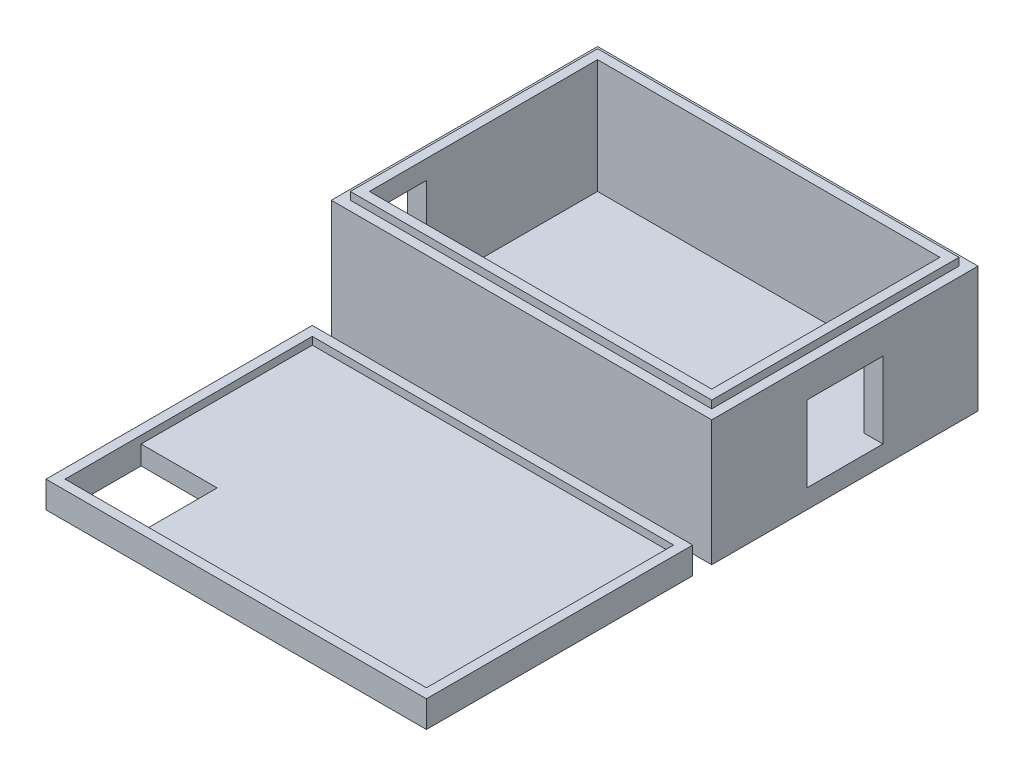
from build123d import *

# Parameters (mm, degrees)
SKETCH_1_W           = 100
SKETCH_1_H           = 70
EXTRUDE_9_DEPTH      = 40
SKETCH_7_W           = 90
SKETCH_7_H           = 60
CUT_EXTRUDE_1_DEPTH  = 35
SKETCH_8_W           = 95
SKETCH_8_H           = 65
CUT_EXTRUDE_3_DEPTH  = 5
SKETCH_1_6_W         = 100
SKETCH_1_6_H         = 70
SKETCH_1_6_W_2       = 90
SKETCH_1_6_H_2       = 60
EXTRUDE_11_DEPTH     = 10
SKETCH_12_W          = 90
SKETCH_12_H          = 60
CUT_EXTRUDE_6_DEPTH  = 5
SKETCH_13_W          = 95
SKETCH_13_H          = 65
CUT_EXTRUDE_7_DEPTH  = 5
SKETCH_18_W          = 100
SKETCH_18_H          = 70
SKETCH_18_W_2        = 95
SKETCH_18_H_2        = 65
CUT_EXTRUDE_10_DEPTH = 7
SKETCH_19_W          = 100
SKETCH_19_H          = 70
CUT_EXTRUDE_12_DEPTH = 3
SKETCH_20_W          = 20
SKETCH_20_H          = 20
CUT_EXTRUDE_14_DEPTH = 13
SKETCH_21_W          = 15
SKETCH_21_H          = 10
CUT_EXTRUDE_16_DEPTH = 13
SKETCH_22_W          = 20
SKETCH_22_H          = 20
CUT_EXTRUDE_17_DEPTH = 13
EXTRUDE_12_DEPTH     = 4


# Read off the part's stored shape, not the designer's step: 凸台-拉伸12
with BuildPart() as part:
    # 草图1 → 凸台-拉伸9 (new body)
    with BuildSketch(Plane(origin=(0, 0, 0), x_dir=(1, 0, 0), z_dir=(0, 1, 0))):
        with Locations((50, 35)):
            Rectangle(SKETCH_1_W, SKETCH_1_H)
    extrude(amount=EXTRUDE_9_DEPTH)

    # 草图7 → 切除-拉伸1 (cut)
    with BuildSketch(Plane(origin=(0, 40, 0), x_dir=(1, 0, 0), z_dir=(0, 1, 0))):
        with Locations((50, 35)):
            Rectangle(SKETCH_7_W, SKETCH_7_H)
    extrude(amount=-CUT_EXTRUDE_1_DEPTH, mode=Mode.SUBTRACT)

    # 草图8 → 切除-拉伸3 (cut)
    with BuildSketch(Plane(origin=(0, 40, 0), x_dir=(1, 0, 0), z_dir=(0, 1, 0))):
        with Locations((50, 35)):
            Rectangle(SKETCH_8_W, SKETCH_8_H)
    extrude(amount=-CUT_EXTRUDE_3_DEPTH, mode=Mode.SUBTRACT)

    # 草图1<6> → 凸台-拉伸11 (add)
    # profile 1 of 2: a face of its own
    with BuildSketch(Plane(origin=(0, 0, 0), x_dir=(1, 0, 0), z_dir=(0, 1, 0))):
        with Locations((50, 35)):
            Rectangle(SKETCH_1_6_W, SKETCH_1_6_H)
        with Locations((50, 35)):
            Rectangle(SKETCH_1_6_W_2, SKETCH_1_6_H_2, mode=Mode.SUBTRACT)
    # profile 2 of 2: a face of its own
    with BuildSketch(Plane(origin=(0, 0, 0), x_dir=(1, 0, 0), z_dir=(0, 1, 0))):
        with Locations((50, -40)):
            Rectangle(SKETCH_1_6_W, SKETCH_1_6_H)
    extrude(amount=EXTRUDE_11_DEPTH)


with BuildPart() as extrude_11_piece_1:
    # of the separate pieces the step leaves, piece 1, a body of its own (extrude_11_pieces)
    add(part.part.solids().sort_by_distance((0, 0, 0))[0])

    # 草图18 → 切除-拉伸10 (cut)
    with BuildSketch(Plane(origin=(0, 40, 0), x_dir=(1, 0, 0), z_dir=(0, 1, 0))):
        with Locations((50, 35)):
            Rectangle(SKETCH_18_W, SKETCH_18_H)
        with Locations((50, 35)):
            Rectangle(SKETCH_18_W_2, SKETCH_18_H_2, mode=Mode.SUBTRACT)
    extrude(amount=-CUT_EXTRUDE_10_DEPTH, mode=Mode.SUBTRACT)

    # 草图20 → 切除-拉伸14 (cut)
    with BuildSketch(Plane(origin=(100, 0, 0), x_dir=(0, 0, -1), z_dir=(1, 0, 0))):
        with Locations((35, 15)):
            Rectangle(SKETCH_20_W, SKETCH_20_H)
    extrude(amount=-CUT_EXTRUDE_14_DEPTH, mode=Mode.SUBTRACT)

    # 草图21 → 切除-拉伸16 (cut)
    with BuildSketch(Plane.ZY):
        with Locations((-12.5, 25)):
            Rectangle(SKETCH_21_W, SKETCH_21_H)
    extrude(amount=-CUT_EXTRUDE_16_DEPTH, mode=Mode.SUBTRACT)

    # 凸台-拉伸12 outline → 凸台-拉伸12 (add)
    # profile 1 of 6: a face of its own
    with BuildSketch(Plane(origin=(0, 0, -70), x_dir=(-1, 0, 0), z_dir=(0, 0, -1))):
        with BuildLine():
            add(Edge.make_bspline(
                [(-69.525171651, 18.592004553), (-70.286665441, 18.592004553), (-70.540496704, 18.972751448), (-70.413581072, 19.321769435)],
                knots=[0, 0, 0, 0, 1, 1, 1, 1], degree=3))
            add(Edge.make_bspline(
                [(-70.350123256, 16.624812262), (-70.286665441, 17.767052947), (-69.556900559, 18.544411191), (-69.525171651, 18.592004553)],
                knots=[0, 0, 0, 0, 1, 1, 1, 1], degree=3))
            add(Edge.make_bspline(
                [(-72.745655804, 14.245144168), (-70.350123256, 16.323387637), (-70.350123256, 16.624812262)],
                knots=[0, 0, 0, 1, 1, 1], degree=2))
            add(Edge.make_bspline(
                [(-70.873650237, 15.038366866), (-72.317315547, 12.753885496), (-72.840842528, 12.753885496), (-72.840842528, 12.722156588), (-72.872571436, 12.76974995), (-73.300911693, 14.245144168), (-72.745655804, 14.245144168)],
                knots=[0, 0, 0, 0, 0, 0, 0, 1, 1, 1, 1, 1, 1, 1], degree=6))
            add(Edge.make_bspline(
                [(-69.207882571, 15.958505196), (-70.491669381, 14.039684199), (-70.651547882, 14.086499628), (-70.571608631, 14.063091914), (-70.715005698, 15.101824682), (-70.873650237, 15.038366866)],
                knots=[0, 0, 0, 0, 0, 0, 1, 1, 1, 1, 1, 1], degree=5))
            add(Edge.make_bspline(
                [(-68.39879542, 15.228740313), (-68.827135676, 15.371520399), (-68.827135676, 15.958505196), (-69.207882571, 15.958505196)],
                knots=[0, 0, 0, 0, 1, 1, 1, 1], degree=3))
            add(Edge.make_bspline(
                [(-66.288823043, 17.386306052), (-68.040058644, 16.095169124), (-68.040058644, 15.482571577), (-68.39879542, 15.228740313)],
                knots=[0, 0, 0, 0, 1, 1, 1, 1], degree=3))
            add(Edge.make_bspline(
                [(-67.764217261, 13.911990635), (-67.351741458, 13.911990635), (-67.351741458, 15.21287586), (-66.294719233, 16.685587553), (-66.288823043, 17.386306052)],
                knots=[0, 0, 0, 0, 0, 1, 1, 1, 1, 1], degree=4))
            add(Edge.make_bspline(
                [(-70.318394349, 12.801478858), (-70.635683428, 13.277412477), (-69.192018117, 13.927855089), (-68.478117689, 14.229279714), (-67.764217261, 13.911990635)],
                knots=[0, 0, 0, 0, 0, 1, 1, 1, 1, 1], degree=4))
            add(Edge.make_bspline(
                [(-68.795406769, 13.213954661), (-69.033373578, 12.753885496), (-70.223207625, 12.658698772), (-70.318394349, 12.801478858)],
                knots=[0, 0, 0, 0, 1, 1, 1, 1], degree=3))
            add(Edge.make_bspline(
                [(-67.526250452, 12.722156588), (-68.018048525, 12.84907222), (-68.39879542, 13.53124374), (-68.795406769, 13.213954661)],
                knots=[0, 0, 0, 0, 1, 1, 1, 1], degree=3))
            add(Edge.make_bspline(
                [(-64.924480002, 17.322848236), (-66.955130109, 12.944258943), (-67.208961373, 12.722156588), (-67.526250452, 12.722156588)],
                knots=[0, 0, 0, 0, 1, 1, 1, 1], degree=3))
            add(Edge.make_bspline(
                [(-65.11485345, 18.417495559), (-64.654784285, 17.719459585), (-64.924480002, 17.322848236)],
                knots=[0, 0, 0, 1, 1, 1], degree=2))
            add(Edge.make_bspline(
                [(-67.018587925, 17.751188493), (-65.654244885, 18.417495559), (-65.11485345, 18.417495559)],
                knots=[0, 0, 0, 1, 1, 1], degree=2))
            add(Edge.make_bspline(
                [(-67.526250452, 18.560275645), (-67.304148096, 17.751188493), (-67.018587925, 17.751188493)],
                knots=[0, 0, 0, 1, 1, 1], degree=2))
            add(Edge.make_bspline(
                [(-66.082585141, 19.686651876), (-67.526250452, 18.893429178), (-67.526250452, 18.560275645)],
                knots=[0, 0, 0, 1, 1, 1], degree=2))
            add(Edge.make_bspline(
                [(-66.399874221, 20.828892561), (-66.018558068, 21.068793452), (-65.527329253, 20.337094488), (-65.670109339, 19.686651876), (-66.082585141, 19.686651876)],
                knots=[0, 0, 0, 0, 0, 1, 1, 1, 1, 1], degree=4))
            add(Edge.make_bspline(
                [(-70.413581072, 19.321769435), (-68.795406769, 19.321769435), (-66.399874221, 20.828892561)],
                knots=[0, 0, 0, 1, 1, 1], degree=2))
        make_face()
        with BuildLine():
            add(Edge.make_bspline(
                [(-68.16082861, 18.274715474), (-68.42605064, 18.375486999), (-68.827135676, 18.211257658)],
                knots=[0, 0, 0, 1, 1, 1], degree=2))
            add(Edge.make_bspline(
                [(-69.382391565, 16.862779071), (-68.519309605, 16.862779071), (-67.986319617, 17.402170506), (-67.986319617, 18.227122112), (-68.16082861, 18.274715474)],
                knots=[0, 0, 0, 0, 0, 1, 1, 1, 1, 1], degree=4))
            add(Edge.make_bspline(
                [(-68.827135676, 18.211257658), (-69.731409552, 17.529086138), (-69.731409552, 16.862779071), (-69.382391565, 16.862779071)],
                knots=[0, 0, 0, 0, 1, 1, 1, 1], degree=3))
        make_face(mode=Mode.SUBTRACT)
    # profile 2 of 6: a face of its own
    with BuildSketch(Plane(origin=(0, 0, -70), x_dir=(-1, 0, 0), z_dir=(0, 0, -1))):
        with BuildLine():
            add(Edge.make_bspline(
                [(-61.945835811, 16.867819008), (-62.536942401, 16.867819008), (-62.74077226, 17.234712754), (-62.659240317, 17.719459585)],
                knots=[0, 0, 0, 0, 1, 1, 1, 1], degree=3))
            add(Edge.make_bspline(
                [(-63.240155414, 15.298329096), (-61.28338877, 16.582457206), (-61.28338877, 17.061457374), (-61.945835811, 16.867819008)],
                knots=[0, 0, 0, 0, 1, 1, 1, 1], degree=3))
            add(Edge.make_bspline(
                [(-62.455410458, 13.046009157), (-63.046517048, 13.046009157), (-63.33187885, 13.525009325), (-63.423602287, 14.819328928), (-63.240155414, 15.298329096)],
                knots=[0, 0, 0, 0, 0, 1, 1, 1, 1, 1], degree=4))
            add(Edge.make_bspline(
                [(-62.638857331, 15.063924758), (-62.638857331, 14.727568963), (-62.129282684, 14.258796816), (-62.129282684, 13.280413495), (-62.455410458, 13.046009157)],
                knots=[0, 0, 0, 0, 0, 1, 1, 1, 1, 1], degree=4))
            add(Edge.make_bspline(
                [(-59.632366915, 16.949350951), (-60.10444294, 16.663989149), (-60.10444294, 15.920010165), (-61.405686685, 15.328903575), (-62.638857331, 15.328903575), (-62.638857331, 15.063924758)],
                knots=[0, 0, 0, 0, 0, 0, 1, 1, 1, 1, 1, 1], degree=5))
            add(Edge.make_bspline(
                [(-59.224707197, 14.778562956), (-58.857813452, 17.020691402), (-59.175416094, 17.225569829), (-59.632366915, 16.949350951)],
                knots=[0, 0, 0, 0, 1, 1, 1, 1], degree=3))
            add(Edge.make_bspline(
                [(-61.066706529, 15.231366238), (-60.305005448, 15.410435518), (-60.305005448, 15.03335028), (-60.146536603, 14.672047263), (-59.550834971, 14.503392647), (-59.224707197, 14.778562956)],
                knots=[0, 0, 0, 0, 0, 0, 1, 1, 1, 1, 1, 1], degree=5))
            add(Edge.make_bspline(
                [(-61.028601447, 13.158115579), (-61.313963249, 13.158115579), (-61.395495193, 13.800179634), (-61.905069839, 14.116115915), (-61.427940878, 15.095037137), (-61.066706529, 15.231366238)],
                knots=[0, 0, 0, 0, 0, 0, 1, 1, 1, 1, 1, 1], degree=5))
            add(Edge.make_bspline(
                [(-59.06164331, 13.260030509), (-59.611983929, 13.260030509), (-60.27750959, 14.395755374), (-60.641324715, 13.92247755), (-60.967452489, 13.168307072), (-61.028601447, 13.158115579)],
                knots=[0, 0, 0, 0, 0, 0, 1, 1, 1, 1, 1, 1], degree=5))
            add(Edge.make_bspline(
                [(-58.083259988, 17.591415006), (-58.083259988, 16.663989149), (-58.745707029, 13.82056262), (-59.06164331, 13.30079648), (-59.06164331, 13.260030509)],
                knots=[0, 0, 0, 0, 0, 1, 1, 1, 1, 1], degree=4))
            add(Edge.make_bspline(
                [(-60.712665166, 17.224521261), (-60.631133222, 16.959542444), (-58.501111199, 18.213096075), (-58.154600439, 18.213096075), (-58.083259988, 17.591415006)],
                knots=[0, 0, 0, 0, 0, 1, 1, 1, 1, 1], degree=4))
            add(Edge.make_bspline(
                [(-58.022111031, 19.522702918), (-57.920196101, 19.018224017), (-60.682090687, 17.275478725), (-60.712665166, 17.224521261)],
                knots=[0, 0, 0, 0, 1, 1, 1, 1], degree=3))
            add(Edge.make_bspline(
                [(-59.122792268, 19.02841551), (-58.389004776, 19.619522101), (-58.022111031, 19.522702918)],
                knots=[0, 0, 0, 1, 1, 1], degree=2))
            add(Edge.make_bspline(
                [(-59.693515872, 20.353309592), (-59.285856155, 20.231011677), (-59.387771084, 18.885734609), (-59.122792268, 19.02841551)],
                knots=[0, 0, 0, 0, 1, 1, 1, 1], degree=3))
            add(Edge.make_bspline(
                [(-62.659240317, 17.719459585), (-61.191665334, 17.836010837), (-60.376345899, 18.885734609), (-60.376345899, 20.159671226), (-59.693515872, 20.353309592)],
                knots=[0, 0, 0, 0, 0, 1, 1, 1, 1, 1], degree=4))
        make_face()
    # profile 3 of 6: a face of its own
    with BuildSketch(Plane(origin=(0, 0, -70), x_dir=(-1, 0, 0), z_dir=(0, 0, -1))):
        with BuildLine():
            add(Edge.make_bspline(
                [(-53.055501412, 18.664033328), (-53.055501412, 19.125760538), (-51.093160773, 19.898265676), (-50.942211493, 20.271199192)],
                knots=[0, 0, 0, 0, 1, 1, 1, 1], degree=3))
            add(Edge.make_bspline(
                [(-50.942211493, 20.271199192), (-51.918942128, 20.271199192), (-52.540497986, 20.084732434), (-52.975587087, 20.679650184), (-53.668177901, 20.981548744)],
                knots=[0, 0, 0, 0, 0, 1, 1, 1, 1, 1], degree=4))
            add(Edge.make_bspline(
                [(-53.668177901, 20.981548744), (-53.814687496, 20.981548744), (-53.961197092, 20.828892561)],
                knots=[0, 0, 0, 1, 1, 1], degree=2))
            add(Edge.make_bspline(
                [(-53.961197092, 20.828892561), (-53.961197092, 20.271199192), (-53.668177901, 20.271199192), (-53.668177901, 19.898265676), (-53.943438353, 19.623005225), (-54.520597365, 19.329986034)],
                knots=[0, 0, 0, 0, 0, 0, 1, 1, 1, 1, 1, 1], degree=5))
            add(Edge.make_bspline(
                [(-54.520597365, 19.329986034), (-54.653787906, 18.912655672), (-53.237528485, 19.192355808), (-53.237528485, 18.841620717), (-54.001169293, 18.306870135), (-55.328619981, 17.580750261)],
                knots=[0, 0, 0, 0, 0, 0, 1, 1, 1, 1, 1, 1], degree=5))
            add(Edge.make_bspline(
                [(-55.328619981, 17.580750261), (-55.435172414, 16.959194402), (-54.920168988, 16.799365753), (-54.245336913, 16.017981244), (-54.298613129, 15.3342698), (-54.59163232, 15.112285565)],
                knots=[0, 0, 0, 0, 0, 0, 1, 1, 1, 1, 1, 1], degree=5))
            add(Edge.make_bspline(
                [(-54.59163232, 15.112285565), (-56.6871635, 13.265376728), (-57.228805034, 13.149944925), (-57.495186117, 13.149944925)],
                knots=[0, 0, 0, 0, 1, 1, 1, 1], degree=3))
            add(Edge.make_bspline(
                [(-57.495186117, 13.149944925), (-55.621639171, 12.990116276), (-54.422924301, 13.851415109), (-53.814687496, 14.712713941), (-53.508349252, 14.792628266)],
                knots=[0, 0, 0, 0, 0, 1, 1, 1, 1, 1], degree=4))
            add(Edge.make_bspline(
                [(-53.508349252, 14.792628266), (-52.33627249, 12.963478168), (-50.562447693, 12.963478168), (-50.045395182, 13.061151231), (-49.92108401, 13.114427448)],
                knots=[0, 0, 0, 0, 0, 1, 1, 1, 1, 1], degree=4))
            add(Edge.make_bspline(
                [(-49.92108401, 13.114427448), (-50.840765449, 13.511679808), (-52.084744384, 14.532093799), (-52.948948979, 15.547374666), (-52.425066184, 16.373156021), (-52.425066184, 16.568502148)],
                knots=[0, 0, 0, 0, 0, 0, 1, 1, 1, 1, 1, 1], degree=5))
            add(Edge.make_bspline(
                [(-52.425066184, 16.568502148), (-53.259726908, 17.13678179), (-53.668177901, 16.346517913), (-54.094387633, 16.630657734)],
                knots=[0, 0, 0, 0, 1, 1, 1, 1], degree=3))
            add(Edge.make_bspline(
                [(-54.094387633, 16.630657734), (-54.502838626, 17.092384943), (-53.721454118, 17.491956566), (-52.913431501, 18.19342675), (-52.522739247, 17.678423324), (-51.865665911, 17.678423324)],
                knots=[0, 0, 0, 0, 0, 0, 1, 1, 1, 1, 1, 1], degree=5))
            add(Edge.make_bspline(
                [(-51.865665911, 17.678423324), (-51.794630956, 18.610757112), (-52.655929789, 18.726188914), (-53.055501412, 18.664033328)],
                knots=[0, 0, 0, 0, 1, 1, 1, 1], degree=3))
        make_face()
    # profile 4 of 6: a face of its own
    with BuildSketch(Plane(origin=(0, 0, -70), x_dir=(-1, 0, 0), z_dir=(0, 0, -1))):
        with BuildLine():
            add(Edge.make_bspline(
                [(-48.095770386, 18.610757112), (-44.477900245, 21.182036284), (-44.030328681, 21.182036284), (-44.030328681, 20.547976569)],
                knots=[0, 0, 0, 0, 1, 1, 1, 1], degree=3))
            add(Edge.make_bspline(
                [(-48.095770386, 18.610757112), (-47.583878283, 18.551633151), (-46.976207388, 18.56762449)],
                knots=[0, 0, 0, 1, 1, 1], degree=2))
            add(Edge.make_bspline(
                [(-45.409056132, 19.958871014), (-46.67237194, 18.65824208), (-46.976207388, 18.56762449)],
                knots=[0, 0, 0, 1, 1, 1], degree=2))
            add(Edge.make_bspline(
                [(-47.714424992, 16.035491235), (-47.552321201, 15.967784414), (-46.709716059, 17.400903815), (-45.866706686, 18.142944238), (-45.643616287, 18.926145369), (-45.190507828, 19.825609852), (-45.233151399, 20.03882771), (-45.409056132, 19.958871014)],
                knots=[0, 0, 0, 0, 0, 0, 0, 0, 1, 1, 1, 1, 1, 1, 1, 1], degree=7))
            add(Edge.make_bspline(
                [(-48.507071117, 16.857713708), (-48.17581602, 16.609272385), (-47.714424992, 16.035491235)],
                knots=[0, 0, 0, 1, 1, 1], degree=2))
            add(Edge.make_bspline(
                [(-48.347358838, 15.443964276), (-48.885648371, 16.360831063), (-48.885648371, 16.798561012), (-48.507071117, 16.857713708)],
                knots=[0, 0, 0, 0, 1, 1, 1, 1], degree=3))
            add(Edge.make_bspline(
                [(-49.366074042, 14.61233632), (-48.554393274, 14.509351681), (-48.371019917, 15.035810675), (-47.838645654, 15.160031336), (-47.797238766, 15.443964276), (-48.347358838, 15.443964276)],
                knots=[0, 0, 0, 0, 0, 0, 1, 1, 1, 1, 1, 1], degree=5))
            add(Edge.make_bspline(
                [(-46.729376752, 12.880695838), (-49.54917802, 14.219970652), (-49.54917802, 14.61233632), (-49.366074042, 14.61233632)],
                knots=[0, 0, 0, 0, 1, 1, 1, 1], degree=3))
            add(Edge.make_bspline(
                [(-43.313179668, 13.335840013), (-45.133756368, 12.29999465), (-46.075433972, 12.352310072), (-46.729376752, 12.880695838)],
                knots=[0, 0, 0, 0, 1, 1, 1, 1], degree=3))
            add(Edge.make_bspline(
                [(-46.82005195, 14.5781611), (-47.535034257, 14.465853138), (-47.608275849, 14.235665279), (-46.671829787, 13.634037921), (-44.029900955, 13.320145387), (-43.370726633, 13.320145387), (-43.313179668, 13.335840013)],
                knots=[0, 0, 0, 0, 0, 0, 0, 1, 1, 1, 1, 1, 1, 1], degree=6))
            add(Edge.make_bspline(
                [(-45.990117076, 14.235121352), (-46.405084513, 14.235121352), (-46.476183588, 16.331947879), (-46.665130773, 16.36528753), (-46.82005195, 15.76773442), (-46.82005195, 14.5781611)],
                knots=[0, 0, 0, 0, 0, 0, 1, 1, 1, 1, 1, 1], degree=5))
            add(Edge.make_bspline(
                [(-45.746019676, 14.170081783), (-45.436827159, 14.959931143), (-45.436827159, 15.878392404), (-45.835195899, 15.64047774), (-45.934788084, 14.550496605), (-45.990117076, 14.235121352)],
                knots=[0, 0, 0, 0, 0, 0, 1, 1, 1, 1, 1, 1], degree=5))
            add(Edge.make_bspline(
                [(-44.030328681, 20.547976569), (-44.776281287, 19.373101214), (-44.254114463, 18.589850977), (-44.944120624, 18.38471401), (-44.254114463, 18.38471401), (-44.477900245, 17.351168529), (-44.869525363, 16.10955856), (-45.11195996, 14.170081783), (-45.746019676, 14.170081783)],
                knots=[0, 0, 0, 0, 0, 0, 0, 0, 0, 1, 1, 1, 1, 1, 1, 1, 1, 1], degree=8))
        make_face()
        with BuildLine():
            add(Edge.make_bspline(
                [(-45.130418693, 16.950928272), (-45.130418693, 17.871775541), (-45.304252106, 17.965739548)],
                knots=[0, 0, 0, 1, 1, 1], degree=2))
            add(Edge.make_bspline(
                [(-45.769373941, 17.044892279), (-45.604936929, 16.589166845), (-45.285459305, 16.589166845), (-45.130418693, 16.950928272)],
                knots=[0, 0, 0, 0, 1, 1, 1, 1], degree=3))
            add(Edge.make_bspline(
                [(-45.304252106, 17.965739548), (-45.957301955, 17.298595098), (-45.769373941, 17.044892279)],
                knots=[0, 0, 0, 1, 1, 1], degree=2))
        make_face(mode=Mode.SUBTRACT)
    # profile 5 of 6: a face of its own
    with BuildSketch(Plane(origin=(0, 0, -70), x_dir=(-1, 0, 0), z_dir=(0, 0, -1))):
        with BuildLine():
            add(Edge.make_bspline(
                [(-35.691939123, 18.475345011), (-37.042147345, 18.183774103), (-37.324378086, 18.366393995)],
                knots=[0, 0, 0, 1, 1, 1], degree=2))
            add(Edge.make_bspline(
                [(-37.324378086, 18.366393995), (-36.295065971, 19.661335043), (-36.295065971, 20.342009183)],
                knots=[0, 0, 0, 1, 1, 1], degree=2))
            add(Edge.make_bspline(
                [(-36.295065971, 20.342009183), (-36.544093095, 20.624239925), (-36.925934686, 20.679650184)],
                knots=[0, 0, 0, 1, 1, 1], degree=2))
            add(Edge.make_bspline(
                [(-36.925934686, 20.679650184), (-38.187672118, 18.084163254), (-38.7521336, 18.084163254)],
                knots=[0, 0, 0, 1, 1, 1], degree=2))
            add(Edge.make_bspline(
                [(-38.7521336, 18.084163254), (-40.146685498, 18.084163254), (-39.864454757, 17.619312621)],
                knots=[0, 0, 0, 1, 1, 1], degree=2))
            add(Edge.make_bspline(
                [(-39.864454757, 17.619312621), (-38.9513553, 16.872231247), (-39.814649332, 15.793113707)],
                knots=[0, 0, 0, 1, 1, 1], degree=2))
            add(Edge.make_bspline(
                [(-39.814649332, 15.793113707), (-42.553947703, 13.336046077), (-42.885983869, 13.170027994)],
                knots=[0, 0, 0, 1, 1, 1], degree=2))
            add(Edge.make_bspline(
                [(-42.885983869, 13.170027994), (-41.674051863, 12.970806295), (-38.7521336, 15.560688391)],
                knots=[0, 0, 0, 1, 1, 1], degree=2))
            add(Edge.make_bspline(
                [(-38.7521336, 15.560688391), (-37.09195277, 13.933711177), (-36.245260546, 13.933711177)],
                knots=[0, 0, 0, 1, 1, 1], degree=2))
            add(Edge.make_bspline(
                [(-36.245260546, 13.933711177), (-35.049930348, 14.747199784), (-35.099735773, 14.913217867)],
                knots=[0, 0, 0, 1, 1, 1], degree=2))
            add(Edge.make_bspline(
                [(-35.099735773, 14.913217867), (-36.444482245, 14.7804034), (-38.187672118, 16.141751682)],
                knots=[0, 0, 0, 1, 1, 1], degree=2))
            add(Edge.make_bspline(
                [(-38.187672118, 16.141751682), (-37.174961811, 17.453294538), (-35.763808105, 17.851737937), (-35.481577364, 18.233579528), (-35.691939123, 18.475345011)],
                knots=[0, 0, 0, 0, 0, 1, 1, 1, 1, 1], degree=4))
        make_face()
    # profile 6 of 6: a face of its own
    with BuildSketch(Plane(origin=(0, 0, -70), x_dir=(-1, 0, 0), z_dir=(0, 0, -1))):
        with BuildLine():
            add(Edge.make_bspline(
                [(-32.54578085, 18.032851475), (-33.134192903, 18.87093776), (-33.177017292, 19.658935221)],
                knots=[0, 0, 0, 1, 1, 1], degree=2))
            add(Edge.make_bspline(
                [(-30.992161306, 18.391866154), (-31.196215697, 18.595920546), (-31.790635012, 17.930525791), (-32.54578085, 18.032851475)],
                knots=[0, 0, 0, 0, 1, 1, 1, 1], degree=3))
            add(Edge.make_bspline(
                [(-33.591636814, 16.395681891), (-30.894570075, 18.205555623), (-30.992161306, 18.391866154)],
                knots=[0, 0, 0, 1, 1, 1], degree=2))
            add(Edge.make_bspline(
                [(-33.742459625, 15.295562563), (-34.052977177, 15.499616955), (-34.052977177, 16.058548549), (-33.591636814, 16.395681891)],
                knots=[0, 0, 0, 0, 1, 1, 1, 1], degree=3))
            add(Edge.make_bspline(
                [(-31.267191138, 16.697327513), (-30.921185866, 16.697327513), (-30.743747264, 17.203027526), (-31.045392886, 17.495801218), (-31.61319641, 17.158667876), (-32.340694675, 16.502145052), (-33.494045583, 15.295562563), (-33.742459625, 15.295562563)],
                knots=[0, 0, 0, 0, 0, 0, 0, 0, 1, 1, 1, 1, 1, 1, 1, 1], degree=7))
            add(Edge.make_bspline(
                [(-31.520643952, 16.011434064), (-31.959201683, 16.386809961), (-31.267191138, 16.697327513)],
                knots=[0, 0, 0, 1, 1, 1], degree=2))
            add(Edge.make_bspline(
                [(-32.68139724, 15.331822035), (-31.764221714, 15.437071686), (-31.129716678, 15.969334204), (-31.520643952, 16.011434064)],
                knots=[0, 0, 0, 0, 1, 1, 1, 1], degree=3))
            add(Edge.make_bspline(
                [(-31.213072768, 15.054004155), (-32.016820875, 14.471782034), (-32.585168988, 14.525910426), (-32.855810946, 14.892780636), (-32.855810946, 15.253636581), (-32.68139724, 15.331822035)],
                knots=[0, 0, 0, 0, 0, 0, 1, 1, 1, 1, 1, 1], degree=5))
            add(Edge.make_bspline(
                [(-30.823939048, 13.514562878), (-30.823939048, 15.11814874), (-30.943665509, 15.336240331), (-31.213072768, 15.054004155)],
                knots=[0, 0, 0, 0, 1, 1, 1, 1], degree=3))
            add(Edge.make_bspline(
                [(-33.278495732, 14.015492814), (-30.939152933, 13.359274598), (-30.823939048, 13.514562878)],
                knots=[0, 0, 0, 1, 1, 1], degree=2))
            add(Edge.make_bspline(
                [(-30.414994839, 12.250332982), (-32.121347581, 12.983577147), (-33.203356242, 13.910297528), (-33.278495732, 14.015492814)],
                knots=[0, 0, 0, 0, 1, 1, 1, 1], degree=3))
            add(Edge.make_bspline(
                [(-30.191445594, 15.237078359), (-30.191445594, 12.180925445), (-30.414994839, 12.250332982)],
                knots=[0, 0, 0, 1, 1, 1], degree=2))
            add(Edge.make_bspline(
                [(-28.623171071, 15.858606511), (-28.782166645, 15.417755147), (-30.054131235, 15.352711503), (-30.191445594, 15.237078359)],
                knots=[0, 0, 0, 0, 1, 1, 1, 1], degree=3))
            add(Edge.make_bspline(
                [(-30.395469674, 16.036007461), (-30.155310237, 15.916423083), (-28.941162219, 16.299457875), (-28.623171071, 15.858606511)],
                knots=[0, 0, 0, 0, 1, 1, 1, 1], degree=3))
            add(Edge.make_bspline(
                [(-28.61613938, 17.38406571), (-29.866227375, 17.072754529), (-30.184218523, 17.022165028), (-30.395469674, 16.036007461)],
                knots=[0, 0, 0, 0, 1, 1, 1, 1], degree=3))
            add(Edge.make_bspline(
                [(-29.143997401, 18.364373463), (-27.748944059, 18.731988871), (-27.513293157, 18.515190041), (-27.57927541, 17.845941478), (-28.239097936, 17.516030215), (-28.61613938, 17.38406571)],
                knots=[0, 0, 0, 0, 0, 0, 1, 1, 1, 1, 1, 1], degree=5))
            add(Edge.make_bspline(
                [(-27.871482528, 20.428675367), (-29.294813978, 18.364373463), (-29.143997401, 18.364373463)],
                knots=[0, 0, 0, 1, 1, 1], degree=2))
            add(Edge.make_bspline(
                [(-29.239344319, 21.519449027), (-29.180809818, 21.248061793), (-28.430503934, 21.248061793), (-28.159116699, 21.562019574), (-27.477987953, 21.519449027), (-27.477987953, 21.258166544), (-27.739518023, 20.598344017), (-27.871482528, 20.428675367)],
                knots=[0, 0, 0, 0, 0, 0, 0, 0, 1, 1, 1, 1, 1, 1, 1, 1], degree=7))
            add(Edge.make_bspline(
                [(-31.230748142, 20.426922507), (-30.12800448, 21.524770346), (-30.12800448, 22.402787869), (-29.510731554, 22.269754911), (-29.239344319, 21.519449027)],
                knots=[0, 0, 0, 0, 0, 1, 1, 1, 1, 1], degree=4))
            add(Edge.make_bspline(
                [(-32.430070753, 20.96346157), (-31.546359355, 19.448527745), (-31.093983283, 19.585292604), (-31.230748142, 20.426922507)],
                knots=[0, 0, 0, 0, 1, 1, 1, 1], degree=3))
            add(Edge.make_bspline(
                [(-31.72520571, 18.754183075), (-32.766722714, 20.700452225), (-32.430070753, 20.96346157)],
                knots=[0, 0, 0, 1, 1, 1], degree=2))
            add(Edge.make_bspline(
                [(-33.177017292, 19.658935221), (-32.124979913, 18.470132983), (-31.72520571, 18.754183075)],
                knots=[0, 0, 0, 1, 1, 1], degree=2))
        make_face()
        with BuildLine():
            add(Edge.make_bspline(
                [(-29.743592402, 19.788780318), (-30.039712456, 20.204237939), (-30.234701512, 19.903978751)],
                knots=[0, 0, 0, 1, 1, 1], degree=2))
            add(Edge.make_bspline(
                [(-30.234701512, 19.903978751), (-30.758966705, 19.220586328), (-30.563182075, 18.957258354), (-29.901232363, 19.46743732), (-29.743592402, 19.788780318)],
                knots=[0, 0, 0, 0, 0, 1, 1, 1, 1, 1], degree=4))
        make_face(mode=Mode.SUBTRACT)
        with BuildLine():
            add(Edge.make_bspline(
                [(-29.252483293, 19.497752697), (-28.9415162, 19.62598655), (-28.240308437, 20.757939609), (-28.430503934, 21.116593836)],
                knots=[0, 0, 0, 0, 1, 1, 1, 1], degree=3))
            add(Edge.make_bspline(
                [(-28.430503934, 21.116593836), (-29.57382629, 20.510286294), (-29.49500631, 20.085871014), (-29.252483293, 19.497752697)],
                knots=[0, 0, 0, 0, 1, 1, 1, 1], degree=3))
        make_face(mode=Mode.SUBTRACT)
    extrude(amount=EXTRUDE_12_DEPTH)


with BuildPart() as extrude_11_piece_2:
    # of the separate pieces the step leaves, piece 2, a body of its own (extrude_11_pieces)
    add(part.part.solids().sort_by_distance((0, 0, 5))[0])

    # 草图12 → 切除-拉伸6 (cut)
    with BuildSketch(Plane(origin=(0, 10, 0), x_dir=(1, 0, 0), z_dir=(0, 1, 0))):
        with Locations((50, -40)):
            Rectangle(SKETCH_12_W, SKETCH_12_H)
    extrude(amount=-CUT_EXTRUDE_6_DEPTH, mode=Mode.SUBTRACT)

    # 草图13 → 切除-拉伸7 (cut)
    with BuildSketch(Plane(origin=(0, 10, 0), x_dir=(1, 0, 0), z_dir=(0, 1, 0))):
        with Locations((50, -40)):
            Rectangle(SKETCH_13_W, SKETCH_13_H)
    extrude(amount=-CUT_EXTRUDE_7_DEPTH, mode=Mode.SUBTRACT)

    # 草图19 → 切除-拉伸12 (cut)
    with BuildSketch(Plane(origin=(0, 10, 0), x_dir=(1, 0, 0), z_dir=(0, 1, 0))):
        with Locations((50, -40)):
            Rectangle(SKETCH_19_W, SKETCH_19_H)
    extrude(amount=-CUT_EXTRUDE_12_DEPTH, mode=Mode.SUBTRACT)

    # 草图22 → 切除-拉伸17 (cut)
    with BuildSketch(Plane(origin=(0, 5, 0), x_dir=(1, 0, 0), z_dir=(0, 1, 0))):
        with Locations((12.5, -62.5)):
            Rectangle(SKETCH_22_W, SKETCH_22_H)
    extrude(amount=-CUT_EXTRUDE_17_DEPTH, mode=Mode.SUBTRACT)


solid = Compound([extrude_11_piece_1.part, extrude_11_piece_2.part])
